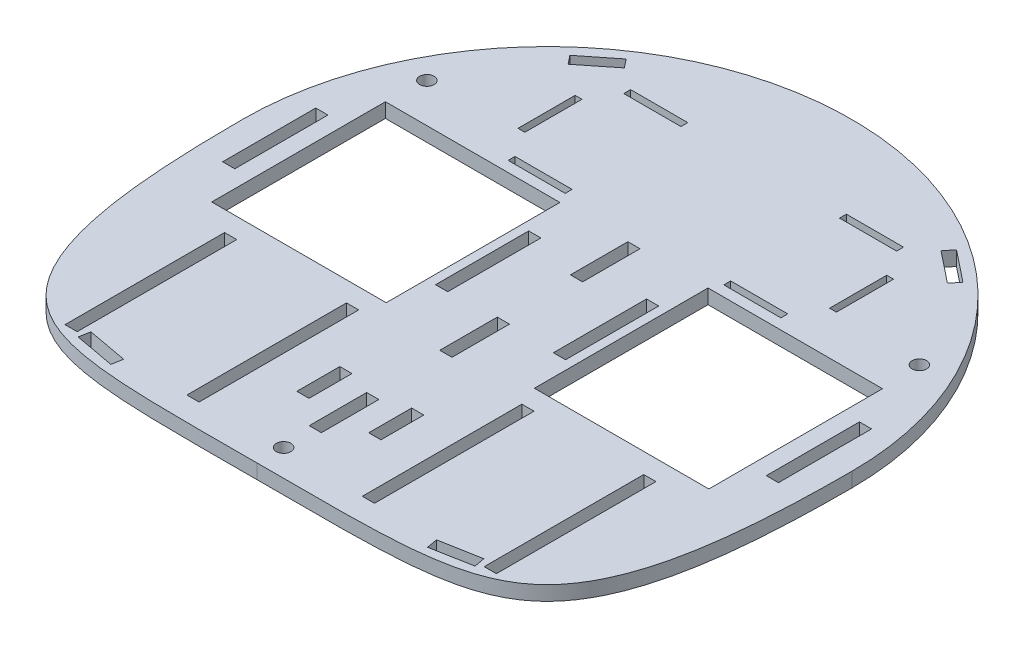
from build123d import *

# Parameters (mm, degrees)
BASE_DEPTH            = 6.35
SKETCH6_W             = 76.3515
SKETCH6_H             = 76
SKETCH6_W_2           = 5.334
SKETCH6_H_2           = 40.767
WHEELSHAFTCUT_DEPTH   = 189.692256213
SKETCH8_W             = 5.334
SKETCH8_H             = 69.827
SKETCH8_H_2           = 18.796
MOTORCUT_DEPTH        = 189.692256213
SKETCH10_W            = 25
SKETCH10_H            = 3
SKETCH10_W_2          = 3
SKETCH10_H_2          = 25
VELCROCUT_DEPTH       = 189.692256213
SKETCH11_R            = 3.175
SCREWCUT_DEPTH        = 189.692256213
SKETCH13_W            = 5.334
SKETCH13_H            = 25.146
SUPPORTSTRUTCUT_DEPTH = 189.692256213
TAPESENSORCUT_DEPTH   = 189.692256213


with BuildPart() as part:
    # Sketch1 → Base (new body)
    with BuildSketch(Plane(origin=(0, 0, 0), x_dir=(1, 0, 0), z_dir=(0, 1, 0))):
        with BuildLine():
            ThreePointArc((133.35, 0), (0, 133.35), (-133.35, 0))
            add(Edge.make_bspline(
                [(-133.35, 0), (-133.35, -51.197979728), (-123.803376308, -129.805052089), (-58.427993604, -127), (0, -127)],
                knots=[0, 0, 0, 0, 0.502616309, 1, 1, 1, 1], degree=3))
            add(Edge.make_bspline(
                [(133.35, 0), (133.35, -51.197979728), (123.803376308, -129.805052089), (58.427993604, -127), (0, -127)],
                knots=[0, 0, 0, 0, 0.502616309, 1, 1, 1, 1], degree=3))
        make_face()
    extrude(amount=BASE_DEPTH)

    # Sketch6 → WheelShaftCut (cut, through all)
    with BuildSketch(Plane(origin=(0, 6.35, 0), x_dir=(1, 0, 0), z_dir=(0, 1, 0))):
        with Locations((-70.592348141, 0)):
            Rectangle(SKETCH6_W, SKETCH6_H)
        with Locations((-118.959848141, 0)):
            Rectangle(SKETCH6_W_2, SKETCH6_H_2)
        with Locations((-25.780848141, 0)):
            Rectangle(SKETCH6_W_2, SKETCH6_H_2)
        with Locations((25.780848141, 0)):
            Rectangle(SKETCH6_W_2, SKETCH6_H_2)
        with Locations((118.959848141, 0)):
            Rectangle(SKETCH6_W_2, SKETCH6_H_2)
        with Locations((70.592348141, 0)):
            Rectangle(SKETCH6_W, SKETCH6_H)
    extrude(amount=-WHEELSHAFTCUT_DEPTH, mode=Mode.SUBTRACT)

    # Sketch8 → MotorCut (cut, through all)
    with BuildSketch(Plane(origin=(0, 6.35, 0), x_dir=(1, 0, 0), z_dir=(0, 1, 0))):
        with Locations((-38.378348141, -81.6765)):
            Rectangle(SKETCH8_W, SKETCH8_H)
        with Locations((-91.718348141, -81.6765)):
            Rectangle(SKETCH8_W, SKETCH8_H)
        with Locations((15.718348141, -81.74)):
            Rectangle(SKETCH8_W, SKETCH8_H_2)
        with Locations((91.718348141, -81.6765)):
            Rectangle(SKETCH8_W, SKETCH8_H)
        with Locations((38.378348141, -81.6765)):
            Rectangle(SKETCH8_W, SKETCH8_H)
        with Locations((-15.718348141, -81.74)):
            Rectangle(SKETCH8_W, SKETCH8_H_2)
    extrude(amount=-MOTORCUT_DEPTH, mode=Mode.SUBTRACT)

    # Sketch10 → VelcroCut (cut, through all)
    with BuildSketch(Plane(origin=(0, 6.35, 0), x_dir=(1, 0, 0), z_dir=(0, 1, 0))):
        with Locations((-47.19, 44.12)):
            Rectangle(SKETCH10_W, SKETCH10_H)
        with Locations((-47.19, 94.745)):
            Rectangle(SKETCH10_W, SKETCH10_H)
        with Locations((-68.175, 69.4325)):
            Rectangle(SKETCH10_W_2, SKETCH10_H_2)
        with Locations((68.175, 69.4325)):
            Rectangle(SKETCH10_W_2, SKETCH10_H_2)
        with Locations((47.19, 94.745)):
            Rectangle(SKETCH10_W, SKETCH10_H)
        with Locations((47.19, 44.12)):
            Rectangle(SKETCH10_W, SKETCH10_H)
    extrude(amount=-VELCROCUT_DEPTH, mode=Mode.SUBTRACT)

    # Sketch11 → ScrewCut (cut, through all)
    with BuildSketch(Plane(origin=(0, 6.35, 0), x_dir=(1, 0, 0), z_dir=(0, 1, 0))):
        with Locations((0, -115.316)):
            Circle(SKETCH11_R)
        with Locations((-107.775, 55.145)):
            Circle(SKETCH11_R)
        with Locations((107.775, 55.145)):
            Circle(SKETCH11_R)
    extrude(amount=-SCREWCUT_DEPTH, mode=Mode.SUBTRACT)

    # Sketch13 → SupportStrutCut (cut, through all)
    with BuildSketch(Plane(origin=(0, 6.35, 0), x_dir=(1, 0, 0), z_dir=(0, 1, 0))):
        with Locations((0, 25.427)):
            Rectangle(SKETCH13_W, SKETCH13_H)
        with Locations((0, -31.723)):
            Rectangle(SKETCH13_W, SKETCH13_H)
        with Locations((0, -88.873)):
            Rectangle(SKETCH13_W, SKETCH13_H)
    extrude(amount=-SUPPORTSTRUTCUT_DEPTH, mode=Mode.SUBTRACT)

    # Sketch15 → TapeSensorCut (cut, through all)
    with BuildSketch(Plane(origin=(0, 6.35, 0), x_dir=(1, 0, 0), z_dir=(0, 1, 0))):
        Polygon((-86.848732385, -118.396296281), (-69.322732385, -121.616839259), (-68.450519947, -116.870311953), (-85.976519947, -113.649768975), align=None)
        Polygon((-83.011458242, 92.17550631), (-69.286608029, 103.074550427), (-72.28779409, 106.853857007), (-86.012644303, 95.954812891), align=None)
        Polygon((86.012644303, 95.954812891), (72.28779409, 106.853857007), (69.286608029, 103.074550427), (83.011458242, 92.17550631), align=None)
        Polygon((85.976519947, -113.649768975), (68.450519947, -116.870311953), (69.322732385, -121.616839259), (86.848732385, -118.396296281), align=None)
    extrude(amount=-TAPESENSORCUT_DEPTH, mode=Mode.SUBTRACT)


solid = part.part
